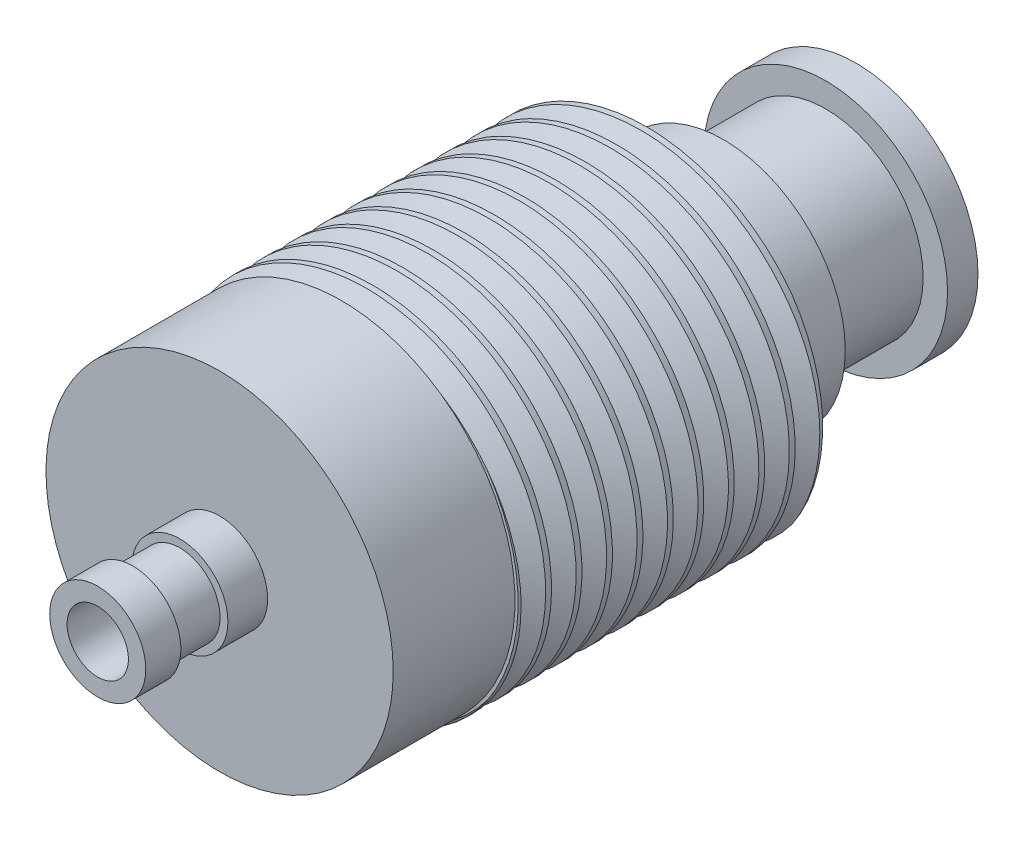
from build123d import *

# Parameters (mm, degrees)
ESQUISSE1_R                           = 2
BOSS_EXTRU_1_DEPTH                    = 0.5
ESQUISSE2_R                           = 1.6
BOSS_EXTRU_2_DEPTH                    = 1.5
ESQUISSE3_R                           = 2
BOSS_EXTRU_3_DEPTH                    = 1.45
ESQUISSE4_R                           = 2.9
BOSS_EXTRU_4_DEPTH                    = 5
ENL_VEMENT_DE_MATI_RE_BALAYAGE1_PITCH = 0.5
ESQUISSE9_R                           = 2.85
BOSS_EXTRU_5_DEPTH                    = 2
ESQUISSE10_R                          = 0.788354636
BOSS_EXTRU_6_DEPTH                    = 2
ESQUISSE11_R                          = 0.503493346
ENL_V_MAT_EXTRU_1_DEPTH               = 35
ESQUISSE12_W                          = 0.772023581
ESQUISSE12_H                          = 0.25


with BuildPart() as part:
    # Esquisse1 → Boss.-Extru.1 (new body)
    with BuildSketch(Plane.XY):
        Circle(ESQUISSE1_R)
    extrude(amount=BOSS_EXTRU_1_DEPTH)

    # Esquisse2 → Boss.-Extru.2 (add)
    with BuildSketch(Plane.XY.offset(0.5)):
        Circle(ESQUISSE2_R)
    extrude(amount=BOSS_EXTRU_2_DEPTH)

    # Esquisse3 → Boss.-Extru.3 (add)
    with BuildSketch(Plane.XY.offset(2)):
        with Locations((-0.178901921, -0.176210286)):
            Circle(ESQUISSE3_R)
    extrude(amount=BOSS_EXTRU_3_DEPTH)

    # Esquisse4 → Boss.-Extru.4 (add)
    with BuildSketch(Plane.XY.offset(3.45)):
        Circle(ESQUISSE4_R)
    extrude(amount=BOSS_EXTRU_4_DEPTH)

    # Enlèvement de matière-Balayage1: arcs per turn and ends read off the stored shape
    # Enlèvement de matière-Balayage1: the profile of Esquisse8 screwed along a right-hand helix through 12 turns, 6 arcs to a turn; built about Z, then put on its axis
    enl_vement_de_mati_re_balayage1_z = Axis((0, 0, 0), (0, 0, 1))
    enl_vement_de_mati_re_balayage1_corners = [(2.550002583, 0, -0.5), (3.074998708, 0, -0.196893346), (3.074998708, 0, -0.803106654)]
    with BuildLine(mode=Mode.PRIVATE) as enl_vement_de_mati_re_balayage1_profile:
        Line(enl_vement_de_mati_re_balayage1_corners[0], enl_vement_de_mati_re_balayage1_corners[1])
        Line(enl_vement_de_mati_re_balayage1_corners[1], enl_vement_de_mati_re_balayage1_corners[2])
        Line(enl_vement_de_mati_re_balayage1_corners[2], enl_vement_de_mati_re_balayage1_corners[0])
    enl_vement_de_mati_re_balayage1_cap = Face(enl_vement_de_mati_re_balayage1_profile.wire())
    enl_vement_de_mati_re_balayage1_turn_angles = [0, 30, 60, 90, 120, 150, 180, 210, 240, 270, 300, 330, 360]
    enl_vement_de_mati_re_balayage1_turn_weights = [1, 0.8660254037844387, 1, 0.8660254037844387, 1, 0.8660254037844387, 1, 0.8660254037844387, 1, 0.8660254037844387, 1, 0.8660254037844387, 1]
    enl_vement_de_mati_re_balayage1_turn_rails = [Edge.make_bspline([Vector(p[0], p[1], 0).rotate(enl_vement_de_mati_re_balayage1_z, enl_vement_de_mati_re_balayage1_turn_angles[k]) / enl_vement_de_mati_re_balayage1_turn_weights[k] + Vector(0, 0, p[2] + ENL_VEMENT_DE_MATI_RE_BALAYAGE1_PITCH * enl_vement_de_mati_re_balayage1_turn_angles[k] / 360) for k in range(13)], [0, 0, 0, 1, 1, 2, 2, 3, 3, 4, 4, 5, 5, 6, 6, 6], 2, enl_vement_de_mati_re_balayage1_turn_weights) for p in enl_vement_de_mati_re_balayage1_corners]
    enl_vement_de_mati_re_balayage1_turn_sides = [Face.make_surface_from_curves(enl_vement_de_mati_re_balayage1_turn_rails[p[0]], enl_vement_de_mati_re_balayage1_turn_rails[p[1]]) for p in [(0, 1), (1, 2), (2, 0)]]
    enl_vement_de_mati_re_balayage1 = Plane(origin=(0, 0, 8.45), x_dir=(-1, 0, 0), z_dir=(0, 0, -1)) * Solid(Shell([*[p.moved(Location((0, 0, ENL_VEMENT_DE_MATI_RE_BALAYAGE1_PITCH * i))) for i in range(12) for p in enl_vement_de_mati_re_balayage1_turn_sides], enl_vement_de_mati_re_balayage1_cap, enl_vement_de_mati_re_balayage1_cap.rotate(enl_vement_de_mati_re_balayage1_z, 4320).moved(Location((0, 0, ENL_VEMENT_DE_MATI_RE_BALAYAGE1_PITCH * 4320 / 360)))]))
    add(enl_vement_de_mati_re_balayage1, mode=Mode.SUBTRACT)

    # Esquisse9 → Boss.-Extru.5 (add)
    with BuildSketch(Plane.XY.offset(8.45)):
        with Locations(Location((0, 0, 0), (0, 0, 305.067078062))):
            Circle(ESQUISSE9_R)
    extrude(amount=BOSS_EXTRU_5_DEPTH)

    # Esquisse10 → Boss.-Extru.6 (add)
    with BuildSketch(Plane.XY.offset(10.45)):
        Circle(ESQUISSE10_R)
    extrude(amount=BOSS_EXTRU_6_DEPTH)

    # Esquisse11 → Enlèv. mat.-Extru.1 (cut)
    with BuildSketch(Plane.XY.offset(12.45)):
        Circle(ESQUISSE11_R)
    extrude(amount=-ENL_V_MAT_EXTRU_1_DEPTH, mode=Mode.SUBTRACT)

    # Esquisse12 → Enlèvement de matière-Révolution4 (revolve, cut)
    with BuildSketch(Plane(origin=(0, 0, 0), x_dir=(0, 0, -1), z_dir=(1, 0, 0)), mode=Mode.PRIVATE) as enl_vement_de_mati_re_r_volution4_sk:
        with Locations((-11.487709129, 0.784625642)):
            Rectangle(ESQUISSE12_W, ESQUISSE12_H)
    revolve(enl_vement_de_mati_re_r_volution4_sk.sketch.rotate(Axis((0, 0, 13.124181648), (0, 0, -1)), 90), axis=Axis((0, 0, 13.124181648), (0, 0, -1)), mode=Mode.SUBTRACT)


solid = part.part
